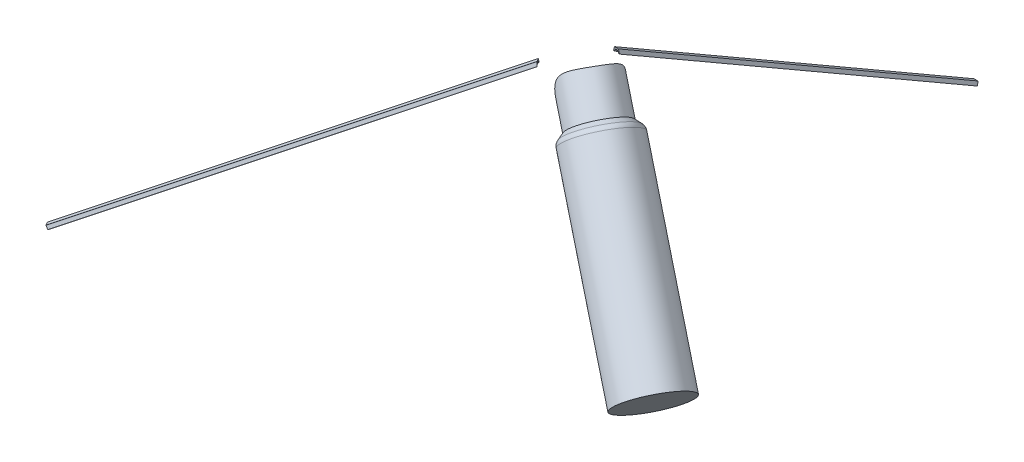
from build123d import *

# Parameters (mm, degrees)
CIRPATTERN2_START   = -259.807621119
CIRPATTERN2_DEPTH   = 346.410161535
SKETCH7_R           = 25
CUT_EXTRUDE1_DEPTH  = 435.415827251
SKETCH9_R           = 20
BOSS_EXTRUDE2_DEPTH = 50
SKETCH10_R          = 25
BOSS_EXTRUDE3_DEPTH = 150
CHAMFER2_SIZE       = 5
SKETCH12_R          = 25
CUT_EXTRUDE2_DEPTH  = 441.105369443
FILLET2_R           = 0.1


with BuildPart() as part:
    # Sweep3: sweep along a path in Sketch5
    with BuildLine(Plane(origin=(0, 0, 0), x_dir=(0, 0, -1), z_dir=(1, 0, 0))) as sweep3_path:
        Line((0, 173.2050808), (300, 0))
    # Sketch6 → Sweep3 (sweep)
    with BuildSketch(Plane(origin=(0, 173.2050808, 0), x_dir=(-1, 0, 0), z_dir=(0, -0.500000000093341, -0.8660254037305483))):
        with BuildLine():
            Line((-1.6180339, -1.6180339), (-2.4270505, -1.6180339))
            Line((-2.4270505, -1.6180339), (-1.5, 1))
            Line((-1.5, 1), (1.5, 1))
            Line((1.5, 1), (2.4270505, -1.6180339))
            Line((2.4270505, -1.6180339), (1.6180339, -1.6180339))
            ThreePointArc((1.6180339, -1.6180339), (0, 0), (-1.6180339, -1.6180339))
        make_face()
    sweep(path=sweep3_path.line)

    # CirPattern2: read off the stored shape, not the designer's step
    # CirPattern2 outline → CirPattern2 (add)
    with BuildSketch(Plane(origin=(0, 0, 0), x_dir=(0.6614378278190619, -0.5669467095390479, 0.49099025293059273), z_dir=(0.7499999999533339, 0.5000000000933409, -0.4330127018652669)).offset(CIRPATTERN2_START)):
        with BuildLine():
            Line((-97.718810887, -115.127251367), (-95.304121077, -113.755100773))
            Line((-95.304121077, -113.755100773), (-95.915680142, -113.225475086))
            ThreePointArc((-95.915680142, -113.225475086), (-98.198050635, -113.389341915), (-98.361917463, -111.106971422))
            Line((-98.361917463, -111.106971422), (-98.973476529, -110.577345735))
            Line((-98.973476529, -110.577345735), (-99.986597725, -113.163290355))
            Line((-99.986597725, -113.163290355), (-97.718810887, -115.127251367))
        make_face()
    extrude(amount=CIRPATTERN2_DEPTH)

    # Sketch7 → Cut-Extrude1 (cut, through all)
    with BuildSketch(Plane(origin=(0, 0, 0), x_dir=(1, 0, 0), z_dir=(0, 1, 0))):
        with Locations((-0.866025404, 0.5)):
            Circle(SKETCH7_R)
    extrude(amount=CUT_EXTRUDE1_DEPTH, mode=Mode.SUBTRACT)


with BuildPart() as cut_extrude1_piece_1:
    # of the separate pieces the step leaves, piece 1, a body of its own (cut_extrude1_pieces)
    add(part.part.solids().sort_by_distance((-258.297974954, -1.401258462, 150.996749986))[0])

    # Fillet2
    fillet2_edges = [cut_extrude1_piece_1.edges().sort_by_distance(p)[0] for p in [
        (-139.732731811, 77.642236986, 82.543074941),
        (-141.399438173, 77.609788679, 79.768659077),
        (-139.287468833, 77.669406772, 83.220174144),
        (-140.363551006, 80.284080644, 82.770984765),
        (-141.908659495, 80.254008319, 80.198951952),
        (-141.787721189, 77.620605535, 79.058662477),
    ]]
    fillet(fillet2_edges, radius=FILLET2_R)


with BuildPart() as cut_extrude1_piece_2:
    # of the separate pieces the step leaves, piece 2, a body of its own (cut_extrude1_pieces)
    add(part.part.solids().sort_by_distance((2.4270505, 156.740072006, -25.282163971))[0])


with BuildPart() as body_3:
    # Sketch9 → Boss-Extrude2 (new body)
    with BuildSketch(Plane(origin=(0, 173.2050808, 0), x_dir=(0.7742767082385598, 0.5579539715562799, -0.2986351364187311), z_dir=(-0.6328472004198645, 0.6826462440832614, -0.36537450151831374))):
        with Locations(Location((0, 0, 0), (0, 0, 161.287709375))):
            Circle(SKETCH9_R)
    extrude(amount=-BOSS_EXTRUDE2_DEPTH)

    # Sketch10 → Boss-Extrude3 (add)
    with BuildSketch(Plane(origin=(-43.184099341, 46.582276417, -24.932351379), x_dir=(0.7742767082385598, 0.5579539715562799, -0.29863513641873113), z_dir=(0.6328472004198645, -0.6826462440832614, 0.36537450151831374))):
        with Locations(Location((96.640462726, 81.733983968, 0), (0, 0, 18.712290625))):
            Circle(SKETCH10_R)
    extrude(amount=BOSS_EXTRUDE3_DEPTH)

    # Chamfer2
    chamfer2_edges = [body_3.edges().sort_by_distance(p)[0] for p in [
        (46.309351779, 152.669803301, 18.268725076),
    ]]
    chamfer(chamfer2_edges, length=CHAMFER2_SIZE - 0.0001)  # a hair under: the kernel refuses the full size

    # Fillet1: read off the stored shape, not the designer's step
    # Fillet1 outline → Fillet1 (revolve, cut)
    with BuildSketch(Plane(origin=(74.826459362, 92.490492179, 43.201076455), x_dir=(0.7742767082385594, 0.55795397155628, -0.2986351364187316), z_dir=(0, -0.4718913763395034, -0.8816566956227401))):
        with BuildLine():
            Line((25, -69.702263958), (25, -66.166730052))
            ThreePointArc((25, -66.166730052), (24.619397663, -68.080147214), (23.535533906, -69.702263958))
            Line((23.535533906, -69.702263958), (25, -69.702263958))
        make_face()
    revolve(axis=Axis((74.826459362, 92.490492179, 43.201076455), (0.6328472004198648, -0.6826462440832607, 0.3653745015183139)), mode=Mode.SUBTRACT)

    # Sketch12 → Cut-Extrude2 (cut, through all)
    with BuildSketch(Plane(origin=(0, 0, 0), x_dir=(1, 0, 0), z_dir=(0, 1, 0))):
        Circle(SKETCH12_R)
    extrude(amount=CUT_EXTRUDE2_DEPTH, mode=Mode.SUBTRACT)


solid = Compound([cut_extrude1_piece_1.part, cut_extrude1_piece_2.part, body_3.part])
